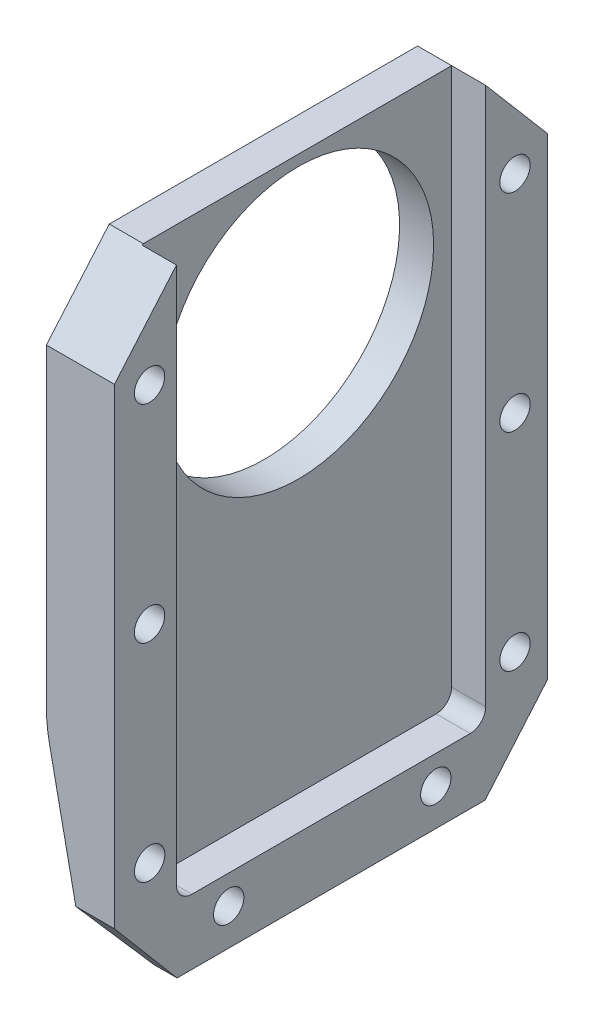
from build123d import *

# Parameters (mm, degrees)
BOSS_EXTRUDE1_DEPTH                   = 35.56
FILLET1_R                             = 12.7
SKETCH6_W                             = 25.384
SKETCH6_H                             = 45.45
CUT_EXTRUDE1_DEPTH                    = 2.794
FILLET2_R                             = 1.27
CUT_EXTRUDE3_DEPTH                    = 63.260576162
CUT_EXTRUDE4_DEPTH                    = 63.260576162
F_7_8_0_875_DIAMETER_HOLE1_D          = 22.225
F_40_0_098_DIAMETER_HOLE1_D           = 2.4892
F_40_0_098_DIAMETER_HOLE1_CSINK_D     = 3.7592
F_40_0_098_DIAMETER_HOLE1_CSINK_ANGLE = 90


with BuildPart() as part:
    # Sketch1 → Boss-Extrude1 (new body)
    with BuildSketch(Plane.XY):
        Polygon((0, 0), (0, 50.8), (-5.588, 50.8), (-5.588, 17.78), (-1.916643762, 0), align=None)
    extrude(amount=BOSS_EXTRUDE1_DEPTH)

    # Fillet1
    fillet1_edges = [part.edges().sort_by_distance(p)[0] for p in [
        (-5.588, 17.78, 17.78),
    ]]
    fillet(fillet1_edges, radius=FILLET1_R)

    # Sketch6 → Cut-Extrude1 (cut)
    with BuildSketch(Plane(origin=(0, 0, 0), x_dir=(0, 0, -1), z_dir=(1, 0, 0))):
        with Locations((-17.778, 28.075)):
            Rectangle(SKETCH6_W, SKETCH6_H)
    extrude(amount=-CUT_EXTRUDE1_DEPTH, mode=Mode.SUBTRACT)

    # Fillet2
    fillet2_edges = [part.edges().sort_by_distance(p)[0] for p in [
        (-1.397, 5.35, 30.47),
        (-1.397, 5.35, 5.086),
    ]]
    fillet(fillet2_edges, radius=FILLET2_R)

    # Sketch10 → Cut-Extrude3 (cut, through all)
    with BuildSketch(Plane(origin=(0, 0, 0), x_dir=(0, 0, -1), z_dir=(1, 0, 0))):
        Polygon((-35.56, 44.780420684), (-30.397580851, 50.8), (-35.56, 50.8), align=None)
    extrude(amount=-CUT_EXTRUDE3_DEPTH, mode=Mode.SUBTRACT)

    # Sketch11 → Cut-Extrude4 (cut, through all)
    with BuildSketch(Plane(origin=(0, 0, 0), x_dir=(0, 0, -1), z_dir=(1, 0, 0))):
        Polygon((-5.085545117, 50.8), (0, 50.8), (0, 44.824895363), align=None)
        Polygon((0, 6.029531172), (-5.128692816, 0), (0, 0), align=None)
        Polygon((-35.56, 6.07121688), (-35.56, 0), (-30.417091858, 0), align=None)
    extrude(amount=-CUT_EXTRUDE4_DEPTH, mode=Mode.SUBTRACT)

    # 7/8 (0.875) Diameter Hole1 (through all)
    with Locations(Plane.ZY.offset(5.588)):
        with Locations((17.678535919, 38.809523369)):
            Hole(F_7_8_0_875_DIAMETER_HOLE1_D / 2)

    # #40 (0.098) Diameter Hole1 (through all)
    with Locations(Plane.ZY.offset(5.588)):
        with Locations((2.678535919, 43.309523369), (2.678535919, 26.309523369), (2.678535919, 9.309523369), (9.178535919, 3.009523369), (26.181895158, 2.999179942), (32.672942909, 9.299179942), (32.678535919, 26.309523369), (32.678535919, 43.299179942)):
            CounterSinkHole(F_40_0_098_DIAMETER_HOLE1_D / 2, F_40_0_098_DIAMETER_HOLE1_CSINK_D / 2, counter_sink_angle=F_40_0_098_DIAMETER_HOLE1_CSINK_ANGLE)


solid = part.part
